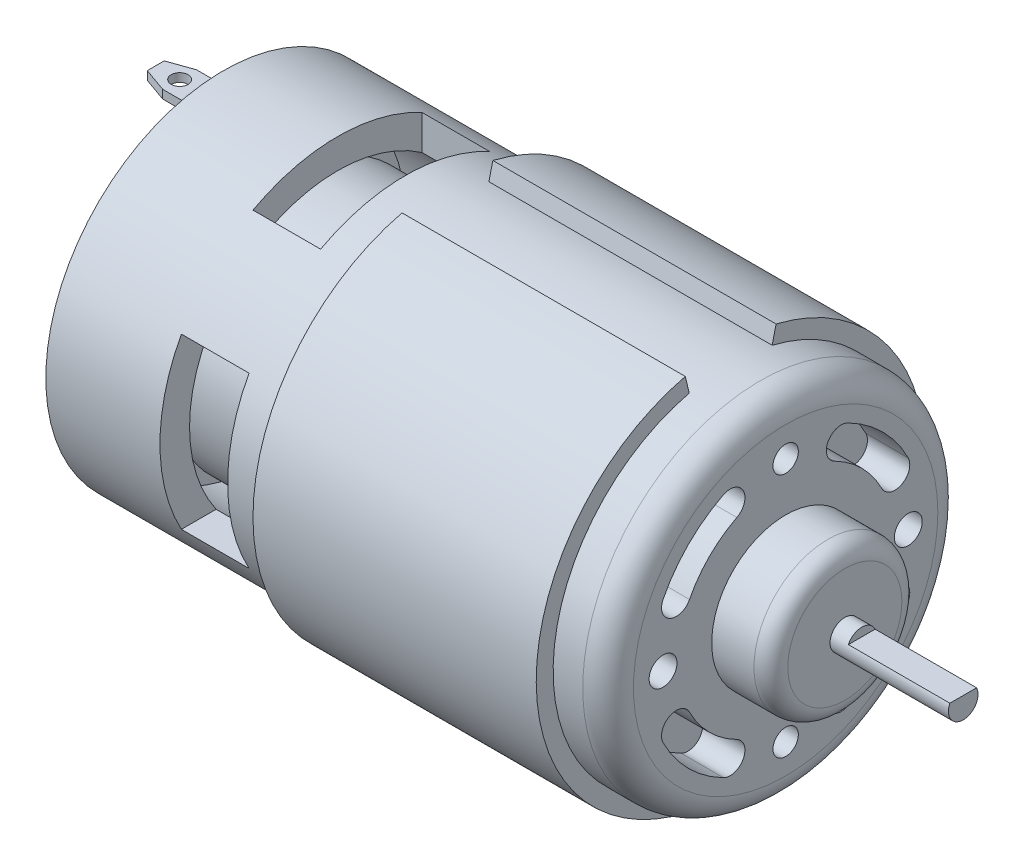
from build123d import *
from OCP.BRepFilletAPI import BRepFilletAPI_MakeChamfer

# Parameters (mm, degrees)
SKETCH1_R               = 21
BOSS_EXTRUDE1_DEPTH     = 66.5
FILLET1_R               = 3
SKETCH2_R               = 8.75
BOSS_EXTRUDE2_DEPTH     = 7
FILLET2_R               = 2
SKETCH3_R               = 1.75
BOSS_EXTRUDE3_DEPTH     = 14
BOSS_EXTRUDE4_START     = -33.5
BOSS_EXTRUDE4_DEPTH     = 33.5
SKETCH5_R               = 19
SKETCH5_W               = 4
SKETCH5_H               = 1
CUT_EXTRUDE1_DEPTH      = 2
SKETCH5_3_W             = 4
SKETCH5_3_H             = 1
BOSS_EXTRUDE5_DEPTH     = 8
CUT_EXTRUDE2_DEPTH      = 37
SKETCH7_W               = 8
SKETCH7_H               = 20
CUT_EXTRUDE3_DEPTH      = 101.604423362
CIRPATTERN1_COUNT       = 2
CIRPATTERN1_ANGLE       = 90
SKETCH9_R               = 17.5
BOSS_EXTRUDE6_DEPTH     = 64.5
CUT_EXTRUDE4_DEPTH      = 100.123660142
CUT_EXTRUDE4_DEPTH_BACK = 100.123660142
SKETCH10_R              = 1
M4_TAPPED_HOLE1_D       = 3.3
M4_TAPPED_HOLE1_DEPTH   = 10.1
M4_TAPPED_HOLE1_TIP     = 0.991420021
SKETCH11_R              = 1.5
CUT_EXTRUDE6_DEPTH      = 5
SKETCH13_R              = 15
BOSS_EXTRUDE7_DEPTH     = 1
CHAMFER1_SIZE           = 2
CHAMFER1_SIZE_2         = 3.5
SKETCH15_W              = 6
SKETCH15_H              = 5
BOSS_EXTRUDE8_DEPTH     = 1
CHAMFER2_SIZE           = 1
CHAMFER2_SIZE_2         = 0.624869352
SKETCH17_R              = 6.184929539
BOSS_EXTRUDE9_DEPTH     = 3
FILLET3_R               = 1
SKETCH19_R              = 2
BOSS_EXTRUDE10_DEPTH    = 3
FILLET4_R               = 1
CUT_EXTRUDE7_DEPTH      = 5
CUT_EXTRUDE8_START      = -26
SKETCH22_R              = 17.5
SKETCH22_R_2            = 15
CUT_EXTRUDE8_DEPTH      = 26
SKETCH23_R              = 17.5
SKETCH23_R_2            = 6
CUT_EXTRUDE9_DEPTH      = 5
CUT_EXTRUDE10_START     = -12
CUT_EXTRUDE10_DEPTH     = 12


# Some blends are built 0.0001 mm under size
with BuildPart() as part:
    # Sketch1 → Boss-Extrude1 (new body)
    with BuildSketch(Plane(origin=(0, 0, 0), x_dir=(0, 0, -1), z_dir=(1, 0, 0))):
        Circle(SKETCH1_R)
    extrude(amount=BOSS_EXTRUDE1_DEPTH)

    # Fillet1
    fillet1_edges = [part.edges().sort_by_distance(p)[0] for p in [
        (66.5, 0, 21),
    ]]
    fillet(fillet1_edges, radius=FILLET1_R)

    # Sketch2 → Boss-Extrude2 (add)
    with BuildSketch(Plane(origin=(66.5, 0, 0), x_dir=(0, 0, -1), z_dir=(1, 0, 0))):
        Circle(SKETCH2_R)
    extrude(amount=BOSS_EXTRUDE2_DEPTH)

    # Fillet2
    fillet2_edges = [part.edges().sort_by_distance(p)[0] for p in [
        (73.5, 0, 8.75),
    ]]
    fillet(fillet2_edges, radius=FILLET2_R)

    # Sketch3 → Boss-Extrude3 (add)
    with BuildSketch(Plane(origin=(73.5, 0, 0), x_dir=(0, 0, -1), z_dir=(1, 0, 0))):
        Circle(SKETCH3_R)
    extrude(amount=BOSS_EXTRUDE3_DEPTH)

    # Sketch4 → Boss-Extrude4 (add)
    with BuildSketch(Plane(origin=(60, 0, 0), x_dir=(0, 0, -1), z_dir=(1, 0, 0)).offset(BOSS_EXTRUDE4_START)):
        with BuildLine():
            Line((-4.902500441, 20.419732844), (-5.369405245, 22.364469305))
            ThreePointArc((-5.369405245, 22.364469305), (-14.239095466, -18.062340942), (23, 0))
            ThreePointArc((23, 0), (18.062340942, 14.239095466), (5.369405245, 22.364469305))
            Line((5.369405245, 22.364469305), (4.902500441, 20.419732844))
            ThreePointArc((4.902500441, 20.419732844), (16.491702599, 13.000913251), (21, 0))
            ThreePointArc((21, 0), (-13.000913251, -16.491702599), (-4.902500441, 20.419732844))
        make_face()
    extrude(amount=BOSS_EXTRUDE4_DEPTH)

    # Sketch5 → Cut-Extrude1 (cut)
    with BuildSketch(Plane.ZY):
        Circle(SKETCH5_R)
        with Locations((0, 17)):
            Rectangle(SKETCH5_W, SKETCH5_H, mode=Mode.SUBTRACT)
        with Locations((0, -17)):
            Rectangle(SKETCH5_W, SKETCH5_H, mode=Mode.SUBTRACT)
    extrude(amount=-CUT_EXTRUDE1_DEPTH, mode=Mode.SUBTRACT)

    # Sketch5<3> → Boss-Extrude5 (add)
    with BuildSketch(Plane.ZY):
        with Locations((0, 17)):
            Rectangle(SKETCH5_3_W, SKETCH5_3_H)
        with Locations((0, -17)):
            Rectangle(SKETCH5_3_W, SKETCH5_3_H)
    extrude(amount=BOSS_EXTRUDE5_DEPTH)

    # Sketch6 → Cut-Extrude2 (cut)
    with BuildSketch(Plane.XZ.offset(17.5)):
        Polygon((-8, -2), (-5.171572875, -2), (-8, -1), align=None)
        Polygon((-8, 2), (-8, 1), (-5.171572875, 2), align=None)
    extrude(amount=-CUT_EXTRUDE2_DEPTH, mode=Mode.SUBTRACT)

    # Sketch7 → Cut-Extrude3 (cut, through all)
    with BuildSketch(Plane(origin=(0, 21, 0), x_dir=(1, 0, 0), z_dir=(0, 1, 0))):
        with Locations((17.5, 0)):
            Rectangle(SKETCH7_W, SKETCH7_H)
    cut_extrude3 = extrude(amount=-CUT_EXTRUDE3_DEPTH, mode=Mode.SUBTRACT)

    # CirPattern1: Cut-Extrude3 ×2 about axis
    cirpattern1_axis = Axis((0, 0, 0), (-1, 0, 0))
    for i in range(1, CIRPATTERN1_COUNT):
        add(cut_extrude3.rotate(cirpattern1_axis, i * CIRPATTERN1_ANGLE / (CIRPATTERN1_COUNT - 1)), mode=Mode.SUBTRACT)

    # Sketch9 → Boss-Extrude6 (add)
    with BuildSketch(Plane.ZY.offset(-2)):
        Circle(SKETCH9_R)
    extrude(amount=-BOSS_EXTRUDE6_DEPTH)

    # Sketch10 → Cut-Extrude4 (cut, two sides: drawn at the far end of the back side and taken through both)
    with BuildSketch(Plane(origin=(0, 17.5, 0), x_dir=(1, 0, 0), z_dir=(0, 1, 0)).offset(-CUT_EXTRUDE4_DEPTH_BACK)):
        with Locations(Location((-5.171572875, 0, 0), (0, 0, 270))):
            Circle(SKETCH10_R)
    extrude(amount=CUT_EXTRUDE4_DEPTH + CUT_EXTRUDE4_DEPTH_BACK, mode=Mode.SUBTRACT)

    # M4 Tapped Hole1
    with Locations(Plane(origin=(66.5, 0, 14.5), x_dir=(0, 0, 1), z_dir=(1, 0, 0))):
        with Locations((0, 0), (-29, 0)):
            Hole(M4_TAPPED_HOLE1_D / 2, depth=M4_TAPPED_HOLE1_DEPTH)
            with Locations((0, 0, -(M4_TAPPED_HOLE1_DEPTH + M4_TAPPED_HOLE1_TIP / 2))):  # 118° drill point
                Cone(0, M4_TAPPED_HOLE1_D / 2, M4_TAPPED_HOLE1_TIP, mode=Mode.SUBTRACT)

    # Sketch11 → Cut-Extrude6 (cut)
    with BuildSketch(Plane(origin=(66.5, 0, 0), x_dir=(0, 0, -1), z_dir=(1, 0, 0))):
        with Locations((0, -14.5)):
            Circle(SKETCH11_R)
        with Locations((0, 14.5)):
            Circle(SKETCH11_R)
        with BuildLine():
            ThreePointArc((-7.357118947, 14.48914424), (-11.490485194, 11.490485194), (-14.48914424, 7.357118947))
            ThreePointArc((-14.48914424, 7.357118947), (-13.721079977, 5.00444445), (-11.36840548, 5.772508712))
            ThreePointArc((-11.36840548, 5.772508712), (-9.01561146, 9.01561146), (-5.772508712, 11.36840548))
            ThreePointArc((-5.772508712, 11.36840548), (-5.00444445, 13.721079977), (-7.357118947, 14.48914424))
        make_face()
        with BuildLine():
            ThreePointArc((14.48914424, 7.357118947), (11.490485194, 11.490485194), (7.357118947, 14.48914424))
            ThreePointArc((7.357118947, 14.48914424), (5.00444445, 13.721079977), (5.772508712, 11.36840548))
            ThreePointArc((5.772508712, 11.36840548), (9.01561146, 9.01561146), (11.36840548, 5.772508712))
            ThreePointArc((11.36840548, 5.772508712), (13.721079977, 5.00444445), (14.48914424, 7.357118947))
        make_face()
        with BuildLine():
            ThreePointArc((7.357118947, -14.48914424), (11.490485194, -11.490485194), (14.48914424, -7.357118947))
            ThreePointArc((14.48914424, -7.357118947), (13.721079977, -5.00444445), (11.36840548, -5.772508712))
            ThreePointArc((11.36840548, -5.772508712), (9.01561146, -9.01561146), (5.772508712, -11.36840548))
            ThreePointArc((5.772508712, -11.36840548), (5.00444445, -13.721079977), (7.357118947, -14.48914424))
        make_face()
        with BuildLine():
            ThreePointArc((-14.48914424, -7.357118947), (-11.490485194, -11.490485194), (-7.357118947, -14.48914424))
            ThreePointArc((-7.357118947, -14.48914424), (-5.00444445, -13.721079977), (-5.772508712, -11.36840548))
            ThreePointArc((-5.772508712, -11.36840548), (-9.01561146, -9.01561146), (-11.36840548, -5.772508712))
            ThreePointArc((-11.36840548, -5.772508712), (-13.721079977, -5.00444445), (-14.48914424, -7.357118947))
        make_face()
    extrude(amount=-CUT_EXTRUDE6_DEPTH, mode=Mode.SUBTRACT)

    # Sketch13 → Boss-Extrude7 (add)
    with BuildSketch(Plane.ZY.offset(-2)):
        Circle(SKETCH13_R)
    extrude(amount=BOSS_EXTRUDE7_DEPTH)

    # Chamfer1
    # the kernel refuses this chamfer: 3.5, 2 mm, written as the material it takes off along each edge
    with BuildSketch(Plane(origin=(1, 0, 0), x_dir=(0, 0, 1), z_dir=(0, -1, 0))) as chamfer1_piece_1_section:
        Polygon((15, -CHAMFER1_SIZE), (15 - CHAMFER1_SIZE_2, 0), (15, 0), align=None)
    chamfer1_piece_1 = revolve(axis=Axis((1, 0, 0), (-1, 0, 0)), mode=Mode.PRIVATE)
    chamfer1_piece_1 = split(chamfer1_piece_1, bisect_by=Plane(origin=(2, 0, -12.345664859), z_dir=(-1, 0, 0)), keep=Keep.TOP, mode=Mode.PRIVATE)
    add(chamfer1_piece_1, mode=Mode.SUBTRACT)

    # Sketch15 → Boss-Extrude8 (add)
    with BuildSketch(Plane.ZY.offset(-2)):
        with Locations((0, 17)):
            Rectangle(SKETCH15_W, SKETCH15_H)
        with Locations((0, -17)):
            Rectangle(SKETCH15_W, SKETCH15_H)
    extrude(amount=BOSS_EXTRUDE8_DEPTH)

    # Chamfer2
    chamfer2_edges_1 = [part.edges().sort_by_distance(p)[0] for p in [
        (1, 16.63083152, 3),
    ]]
    chamfer2_side_1 = [part.faces().sort_by_distance(p)[0] for p in [
        (1, 16.63083152, 2.987502613),
    ]]
    chamfer2_edges_2 = [part.edges().sort_by_distance(p)[0] for p in [
        (1, 16.63083152, -3),
    ]]
    chamfer2_side_2 = [part.faces().sort_by_distance(p)[0] for p in [
        (1.012497387, 16.63083152, -3),
    ]]
    chamfer2_edges_3 = [part.edges().sort_by_distance(p)[0] for p in [
        (1, 14.5, 0),
    ]]
    chamfer2_side_3 = [part.faces().sort_by_distance(p)[0] for p in [
        (1, 14.512497387, 0),
    ]]
    chamfer2_edges_4 = [part.edges().sort_by_distance(p)[0] for p in [
        (1, -16.63083152, -3),
    ]]
    chamfer2_side_4 = [part.faces().sort_by_distance(p)[0] for p in [
        (1, -16.63083152, -2.987502613),
    ]]
    chamfer2_edges_5 = [part.edges().sort_by_distance(p)[0] for p in [
        (1, -16.63083152, 3),
    ]]
    chamfer2_side_5 = [part.faces().sort_by_distance(p)[0] for p in [
        (1.012497387, -16.63083152, 3),
    ]]
    chamfer2_edges_6 = [part.edges().sort_by_distance(p)[0] for p in [
        (1, -14.5, 0),
    ]]
    chamfer2_side_6 = [part.faces().sort_by_distance(p)[0] for p in [
        (1, -14.512497387, 0),
    ]]
    chamfer2 = BRepFilletAPI_MakeChamfer(part.part.solid().wrapped)
    for e in chamfer2_edges_1:
        chamfer2.Add(CHAMFER2_SIZE - 0.0001, CHAMFER2_SIZE_2 - 0.0001, e.wrapped, chamfer2_side_1[0].wrapped)
    for e in chamfer2_edges_2:
        chamfer2.Add(CHAMFER2_SIZE_2 - 0.0001, CHAMFER2_SIZE - 0.0001, e.wrapped, chamfer2_side_2[0].wrapped)
    for e in chamfer2_edges_3:
        chamfer2.Add(CHAMFER2_SIZE - 0.0001, CHAMFER2_SIZE_2 - 0.0001, e.wrapped, chamfer2_side_3[0].wrapped)
    for e in chamfer2_edges_4:
        chamfer2.Add(CHAMFER2_SIZE - 0.0001, CHAMFER2_SIZE_2 - 0.0001, e.wrapped, chamfer2_side_4[0].wrapped)
    for e in chamfer2_edges_5:
        chamfer2.Add(CHAMFER2_SIZE_2 - 0.0001, CHAMFER2_SIZE - 0.0001, e.wrapped, chamfer2_side_5[0].wrapped)
    for e in chamfer2_edges_6:
        chamfer2.Add(CHAMFER2_SIZE - 0.0001, CHAMFER2_SIZE_2 - 0.0001, e.wrapped, chamfer2_side_6[0].wrapped)
    add(Compound.cast(chamfer2.Shape()), mode=Mode.REPLACE)  # a hair under: the kernel refuses the full size

    # Sketch17 → Boss-Extrude9 (add)
    with BuildSketch(Plane.ZY.offset(-1)):
        Circle(SKETCH17_R)
    extrude(amount=BOSS_EXTRUDE9_DEPTH)

    # Fillet3
    fillet3_edges = [part.edges().sort_by_distance(p)[0] for p in [
        (-2, 0, -6.184929539),
    ]]
    fillet(fillet3_edges, radius=FILLET3_R)

    # Sketch19 → Boss-Extrude10 (add)
    with BuildSketch(Plane.ZY.offset(2)):
        Circle(SKETCH19_R)
    extrude(amount=BOSS_EXTRUDE10_DEPTH)

    # Fillet4
    fillet4_edges = [part.edges().sort_by_distance(p)[0] for p in [
        (-5, 0, -2),
    ]]
    fillet(fillet4_edges, radius=FILLET4_R)

    # Sketch20 → Cut-Extrude7 (cut)
    with BuildSketch(Plane.ZY.offset(-1)):
        with BuildLine():
            ThreePointArc((-8.502595121, -2.950572184), (-6.363961031, -6.363961031), (-2.950572184, -8.502595121))
            ThreePointArc((-2.950572184, -8.502595121), (-2.924737516, -7.586524384), (-3.530709504, -6.899028221))
            ThreePointArc((-3.530709504, -6.899028221), (-5.480077554, -5.480077554), (-6.899028221, -3.530709504))
            ThreePointArc((-6.899028221, -3.530709504), (-7.586524384, -2.924737516), (-8.502595121, -2.950572184))
        make_face()
        with BuildLine():
            ThreePointArc((-4.669648054, -9.124521196), (-3.674928455, -9.187215971), (-2.950572184, -8.502595121))
            ThreePointArc((-2.950572184, -8.502595121), (-6.363961031, -6.363961031), (-8.502595121, -2.950572184))
            ThreePointArc((-8.502595121, -2.950572184), (-9.187215971, -3.674928455), (-9.124521196, -4.669648054))
            ThreePointArc((-9.124521196, -4.669648054), (-7.247844507, -7.247844507), (-4.669648054, -9.124521196))
        make_face()
        with BuildLine():
            ThreePointArc((-3.530709504, 6.899028221), (-2.924737516, 7.586524384), (-2.950572184, 8.502595121))
            ThreePointArc((-2.950572184, 8.502595121), (-6.363961031, 6.363961031), (-8.502595121, 2.950572184))
            ThreePointArc((-8.502595121, 2.950572184), (-7.586524384, 2.924737516), (-6.899028221, 3.530709504))
            ThreePointArc((-6.899028221, 3.530709504), (-5.480077554, 5.480077554), (-3.530709504, 6.899028221))
        make_face()
        with BuildLine():
            ThreePointArc((-8.502595121, 2.950572184), (-6.363961031, 6.363961031), (-2.950572184, 8.502595121))
            ThreePointArc((-2.950572184, 8.502595121), (-3.674928455, 9.187215971), (-4.669648054, 9.124521196))
            ThreePointArc((-4.669648054, 9.124521196), (-7.247844507, 7.247844507), (-9.124521196, 4.669648054))
            ThreePointArc((-9.124521196, 4.669648054), (-9.187215971, 3.674928455), (-8.502595121, 2.950572184))
        make_face()
        with BuildLine():
            ThreePointArc((6.899028221, 3.530709504), (7.586524384, 2.924737516), (8.502595121, 2.950572184))
            ThreePointArc((8.502595121, 2.950572184), (6.363961031, 6.363961031), (2.950572184, 8.502595121))
            ThreePointArc((2.950572184, 8.502595121), (2.924737516, 7.586524384), (3.530709504, 6.899028221))
            ThreePointArc((3.530709504, 6.899028221), (5.480077554, 5.480077554), (6.899028221, 3.530709504))
        make_face()
        with BuildLine():
            ThreePointArc((2.950572184, 8.502595121), (6.363961031, 6.363961031), (8.502595121, 2.950572184))
            ThreePointArc((8.502595121, 2.950572184), (9.187215971, 3.674928455), (9.124521196, 4.669648054))
            ThreePointArc((9.124521196, 4.669648054), (7.247844507, 7.247844507), (4.669648054, 9.124521196))
            ThreePointArc((4.669648054, 9.124521196), (3.674928455, 9.187215971), (2.950572184, 8.502595121))
        make_face()
        with BuildLine():
            ThreePointArc((2.950572184, -8.502595121), (6.363961031, -6.363961031), (8.502595121, -2.950572184))
            ThreePointArc((8.502595121, -2.950572184), (7.586524384, -2.924737516), (6.899028221, -3.530709504))
            ThreePointArc((6.899028221, -3.530709504), (5.480077554, -5.480077554), (3.530709504, -6.899028221))
            ThreePointArc((3.530709504, -6.899028221), (2.924737516, -7.586524384), (2.950572184, -8.502595121))
        make_face()
        with BuildLine():
            ThreePointArc((9.124521196, -4.669648054), (9.187215971, -3.674928455), (8.502595121, -2.950572184))
            ThreePointArc((8.502595121, -2.950572184), (6.363961031, -6.363961031), (2.950572184, -8.502595121))
            ThreePointArc((2.950572184, -8.502595121), (3.674928455, -9.187215971), (4.669648054, -9.124521196))
            ThreePointArc((4.669648054, -9.124521196), (7.247844507, -7.247844507), (9.124521196, -4.669648054))
        make_face()
    extrude(amount=-CUT_EXTRUDE7_DEPTH, mode=Mode.SUBTRACT)

    # Sketch22 → Cut-Extrude8 (cut)
    with BuildSketch(Plane(origin=(30, 0, 0), x_dir=(0, 0, -1), z_dir=(1, 0, 0)).offset(CUT_EXTRUDE8_START)):
        Circle(SKETCH22_R)
        Circle(SKETCH22_R_2, mode=Mode.SUBTRACT)
    extrude(amount=CUT_EXTRUDE8_DEPTH, mode=Mode.SUBTRACT)

    # Sketch23 → Cut-Extrude9 (cut)
    with BuildSketch(Plane(origin=(4, 0, 0), x_dir=(0, 0, -1), z_dir=(1, 0, 0))):
        Circle(SKETCH23_R)
        Circle(SKETCH23_R_2, mode=Mode.SUBTRACT)
    extrude(amount=CUT_EXTRUDE9_DEPTH, mode=Mode.SUBTRACT)

    # Sketch24 → Cut-Extrude10 (cut)
    with BuildSketch(Plane(origin=(87.5, 0, 0), x_dir=(0, 0, -1), z_dir=(1, 0, 0)).offset(CUT_EXTRUDE10_START)):
        with BuildLine():
            Line((0, 0.75), (0, 1.75))
            ThreePointArc((0, 1.75), (-0.935414347, 1.479019946), (-1.58113883, 0.75))
            Line((-1.58113883, 0.75), (0, 0.75))
        make_face()
        with BuildLine():
            ThreePointArc((1.58113883, 0.75), (0.935414347, 1.479019946), (0, 1.75))
            Line((0, 1.75), (0, 0.75))
            Line((0, 0.75), (1.58113883, 0.75))
        make_face()
    extrude(amount=CUT_EXTRUDE10_DEPTH, mode=Mode.SUBTRACT)


solid = part.part
